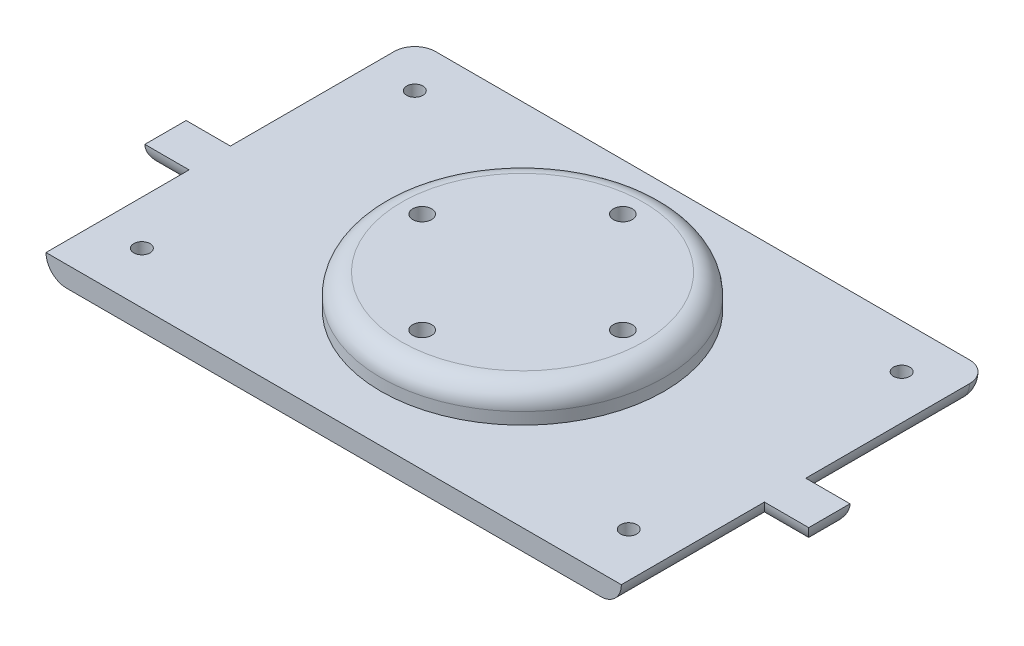
from build123d import *

# Parameters (mm, degrees)
SKETCH2_W               = 195
SKETCH2_H               = 125
BOSS_EXTRUDE1_DEPTH     = 57
SKETCH3_W               = 181
SKETCH3_H               = 118
CUT_EXTRUDE1_DEPTH      = 50
BOSS_EXTRUDE2_DEPTH     = 15
CUT_EXTRUDE4_REACH      = 179.568
SKETCH7_R               = 2.75
SKETCH34_R              = 2
SKETCH34_W              = 22
SKETCH34_H              = 42
CUT_EXTRUDE8_DEPTH      = 7
MIRROR2_COPY_1_DEPTH    = 15
MIRROR2_COPY_2_REACH    = 179.568
MIRROR2_COPY_2_SKETCH_R = 2.75
MIRROR2_COPY_3_SKETCH_R = 2
MIRROR2_COPY_3_SKETCH_W = 22
MIRROR2_COPY_3_SKETCH_H = 42
MIRROR2_COPY_3_DEPTH    = 7
FILLET2_R               = 7
FILLET7_R               = 7
BOSS_EXTRUDE8_REACH     = 282.009
BOSS_EXTRUDE9_REACH     = 282.009
SKETCH29_W              = 460.325022979
SKETCH29_H              = 444.411594697
CUT_EXTRUDE5_DEPTH      = 50
SKETCH30_R              = 48
BOSS_EXTRUDE10_DEPTH    = 11
SKETCH31_R              = 41
CUT_EXTRUDE6_DEPTH      = 11
SKETCH32_R              = 3.2
CUT_EXTRUDE7_DEPTH      = 7
FILLET8_R               = 7
FILLET11_R              = 6.3
SKETCH37_W              = 42
SKETCH37_H              = 75
BOSS_EXTRUDE11_DEPTH    = 7
SKETCH39_W              = 259.645658498
SKETCH39_H              = 116.30884873
CUT_EXTRUDE9_DEPTH      = 125


with BuildPart() as part:
    # Sketch2 → Boss-Extrude1 (new body)
    with BuildSketch(Plane(origin=(0, 0, 0), x_dir=(1, 0, 0), z_dir=(0, 1, 0))):
        with Locations((0, -62.5)):
            Rectangle(SKETCH2_W, SKETCH2_H)
    boss_extrude1 = extrude(amount=BOSS_EXTRUDE1_DEPTH)

    # Sketch3 → Cut-Extrude1 (cut)
    with BuildSketch(Plane(origin=(0, 57, 0), x_dir=(1, 0, 0), z_dir=(0, 1, 0))):
        with Locations((0, -59)):
            Rectangle(SKETCH3_W, SKETCH3_H)
    cut_extrude1 = extrude(amount=-CUT_EXTRUDE1_DEPTH, mode=Mode.SUBTRACT)

    # Sketch5 → Boss-Extrude2 (add)
    with BuildSketch(Plane.ZY.offset(97.5)):
        Polygon((48.5, 7), (48.5, 0), (62.5, 0), (62.5, 57), (55.5, 57), (55.5, 7), align=None)
    boss_extrude2 = extrude(amount=BOSS_EXTRUDE2_DEPTH)

    # Sketch7 → Cut-Extrude4 (cut, up to next)
    with BuildSketch(Plane.XZ, mode=Mode.PRIVATE) as cut_extrude4_sk1:
        with Locations(Location((-82.5, 17.5, 0), (0, 0, 270))):
            Circle(SKETCH7_R)
    cut_extrude4_tool1 = extrude(cut_extrude4_sk1.sketch, amount=-CUT_EXTRUDE4_REACH, mode=Mode.PRIVATE) & part.part
    # Sketch7 → Cut-Extrude4 (cut, up to next)
    with BuildSketch(Plane.XZ, mode=Mode.PRIVATE) as cut_extrude4_sk2:
        with Locations(Location((-82.5, 110, 0), (0, 0, 270))):
            Circle(SKETCH7_R)
    cut_extrude4_tool2 = extrude(cut_extrude4_sk2.sketch, amount=-CUT_EXTRUDE4_REACH, mode=Mode.PRIVATE) & part.part
    cut_extrude4_1 = cut_extrude4_tool1.solids().sort_by_distance((-82.5, 0, 17.5))[0]
    add(cut_extrude4_1, mode=Mode.SUBTRACT)
    cut_extrude4_2 = cut_extrude4_tool2.solids().sort_by_distance((-82.5, 0, 110))[0]
    add(cut_extrude4_2, mode=Mode.SUBTRACT)
    cut_extrude4 = cut_extrude4_1 + cut_extrude4_2  # Cut-Extrude4 as one shape, for the pattern or mirror that repeats it

    # Sketch34 → Cut-Extrude8 (cut)
    with BuildSketch(Plane.XZ):
        with Locations(Location((-57.3, 88.85, 0), (0, 0, 270))):
            Circle(SKETCH34_R)
        with Locations(Location((-67.3, 88.85, 0), (0, 0, 270))):
            Circle(SKETCH34_R)
        with Locations(Location((-78.45, 63.75, 0), (0, 0, 270))):
            Circle(SKETCH34_R)
        with Locations(Location((-46.15, 63.75, 0), (0, 0, 270))):
            Circle(SKETCH34_R)
        with Locations(Location((-57.3, 38.65, 0), (0, 0, 270))):
            Circle(SKETCH34_R)
        with Locations(Location((-67.3, 38.65, 0), (0, 0, 270))):
            Circle(SKETCH34_R)
        with Locations((-62.3, 63.75)):
            Rectangle(SKETCH34_W, SKETCH34_H)
    cut_extrude8 = extrude(amount=-CUT_EXTRUDE8_DEPTH, mode=Mode.SUBTRACT)

    # Mirror1: Boss-Extrude2, Cut-Extrude4, Cut-Extrude8 across plane
    add(boss_extrude2.mirror(Plane(origin=(0, 0, 0), x_dir=(0, 0, 1), z_dir=(1, 0, 0))))
    add(cut_extrude4.mirror(Plane(origin=(0, 0, 0), x_dir=(0, 0, 1), z_dir=(1, 0, 0))), mode=Mode.SUBTRACT)
    add(cut_extrude8.mirror(Plane(origin=(0, 0, 0), x_dir=(0, 0, 1), z_dir=(1, 0, 0))), mode=Mode.SUBTRACT)

    # Mirror2: Boss-Extrude1, Cut-Extrude1, Boss-Extrude2, Cut-Extrude4, Cut-Extrude8 across plane
    add(boss_extrude1.mirror(Plane.XY))
    add(cut_extrude1.mirror(Plane.XY), mode=Mode.SUBTRACT)
    add(boss_extrude2.mirror(Plane.XY))
    add(cut_extrude4.mirror(Plane.XY), mode=Mode.SUBTRACT)
    add(cut_extrude8.mirror(Plane.XY), mode=Mode.SUBTRACT)

    # Mirror2 copy 1 sketch → Mirror2 copy 1 (add)
    with BuildSketch(Plane(origin=(97.5, 0, 0), x_dir=(0, 0, -1), z_dir=(1, 0, 0))):
        Polygon((48.5, 7), (48.5, 0), (62.5, 0), (62.5, 57), (55.5, 57), (55.5, 7), align=None)
    extrude(amount=MIRROR2_COPY_1_DEPTH)

    # Mirror2 copy 2 sketch → Mirror2 copy 2 (cut, up to next)
    with BuildSketch(Plane(origin=(0, 0, 0), x_dir=(-1, 0, 0), z_dir=(0, -1, 0)), mode=Mode.PRIVATE) as mirror2_copy_2_sk1:
        with Locations(Location((-82.5, 17.5, 0), (0, 0, 270))):
            Circle(MIRROR2_COPY_2_SKETCH_R)
    mirror2_copy_2_tool1 = extrude(mirror2_copy_2_sk1.sketch, amount=-MIRROR2_COPY_2_REACH, mode=Mode.PRIVATE) & part.part
    # Mirror2 copy 2 sketch → Mirror2 copy 2 (cut, up to next)
    with BuildSketch(Plane(origin=(0, 0, 0), x_dir=(-1, 0, 0), z_dir=(0, -1, 0)), mode=Mode.PRIVATE) as mirror2_copy_2_sk2:
        with Locations(Location((-82.5, 110, 0), (0, 0, 270))):
            Circle(MIRROR2_COPY_2_SKETCH_R)
    mirror2_copy_2_tool2 = extrude(mirror2_copy_2_sk2.sketch, amount=-MIRROR2_COPY_2_REACH, mode=Mode.PRIVATE) & part.part
    add(mirror2_copy_2_tool1.solids().sort_by_distance((82.5, 0, -17.5))[0], mode=Mode.SUBTRACT)
    add(mirror2_copy_2_tool2.solids().sort_by_distance((82.5, 0, -110))[0], mode=Mode.SUBTRACT)

    # Mirror2 copy 3 sketch → Mirror2 copy 3 (cut)
    with BuildSketch(Plane(origin=(0, 0, 0), x_dir=(-1, 0, 0), z_dir=(0, -1, 0))):
        with Locations(Location((-57.3, 88.85, 0), (0, 0, 270))):
            Circle(MIRROR2_COPY_3_SKETCH_R)
        with Locations(Location((-67.3, 88.85, 0), (0, 0, 270))):
            Circle(MIRROR2_COPY_3_SKETCH_R)
        with Locations(Location((-78.45, 63.75, 0), (0, 0, 270))):
            Circle(MIRROR2_COPY_3_SKETCH_R)
        with Locations(Location((-46.15, 63.75, 0), (0, 0, 270))):
            Circle(MIRROR2_COPY_3_SKETCH_R)
        with Locations(Location((-57.3, 38.65, 0), (0, 0, 270))):
            Circle(MIRROR2_COPY_3_SKETCH_R)
        with Locations(Location((-67.3, 38.65, 0), (0, 0, 270))):
            Circle(MIRROR2_COPY_3_SKETCH_R)
        with Locations((-62.3, 63.75)):
            Rectangle(MIRROR2_COPY_3_SKETCH_W, MIRROR2_COPY_3_SKETCH_H)
    extrude(amount=-MIRROR2_COPY_3_DEPTH, mode=Mode.SUBTRACT)

    # Fillet2
    fillet2_edges = [part.edges().sort_by_distance(p)[0] for p in [
        (-97.5, 28.5, -125),
        (97.5, 28.5, -125),
        (97.5, 28.5, 125),
        (-97.5, 28.5, 125),
    ]]
    fillet(fillet2_edges, radius=FILLET2_R)

    # Fillet7
    fillet7_edges = [part.edges().sort_by_distance(p)[0] for p in [
        (97.5, 0, 0),
        (-97.5, 0, 0),
        (97.5, 0, -90.25),
        (-97.5, 0, 90.25),
        (97.5, 0, 90.25),
        (-97.5, 0, -90.25),
        (0, 0, -125),
        (0, 0, 125),
        (112.5, 0, 55.5),
        (105, 0, 62.5),
        (105, 0, 48.5),
        (-112.5, 0, -55.5),
        (-105, 0, -62.5),
        (-105, 0, -48.5),
        (105, 0, -48.5),
        (105, 0, -62.5),
        (112.5, 0, -55.5),
        (-105, 0, 48.5),
        (-105, 0, 62.5),
        (-95.449747468, 0, 122.949747468),
        (-95.449747468, 0, -122.949747468),
        (95.449747468, 0, -122.949747468),
        (95.449747468, 0, 122.949747468),
        (-112.5, 0, 55.5),
    ]]
    fillet(fillet7_edges, radius=FILLET7_R - 0.0001)  # a hair under: the kernel refuses the full size

    # Sketch26 → Boss-Extrude8 (add, up to next)
    with BuildSketch(Plane.XY.offset(125), mode=Mode.PRIVATE) as boss_extrude8_sk1:
        with BuildLine():
            Line((-90.5, 7), (90.5, 7))
            ThreePointArc((90.5, 7), (88.449747468, 2.050252532), (83.5, 0))
            Line((83.5, 0), (-83.5, 0))
            ThreePointArc((-83.5, 0), (-88.449747468, 2.050252532), (-90.5, 7))
        make_face()
    boss_extrude8_tool1 = extrude(boss_extrude8_sk1.sketch, amount=-BOSS_EXTRUDE8_REACH, mode=Mode.PRIVATE) - part.part
    add(boss_extrude8_tool1.solids().sort_by_distance((0, 3.532685, 125))[0])

    # Sketch27 → Boss-Extrude9 (add, up to next)
    with BuildSketch(Plane(origin=(0, 0, -125), x_dir=(-1, 0, 0), z_dir=(0, 0, -1)), mode=Mode.PRIVATE) as boss_extrude9_sk1:
        with BuildLine():
            Line((-90.5, 7), (90.5, 7))
            ThreePointArc((90.5, 7), (88.449747468, 2.050252532), (83.5, 0))
            Line((83.5, 0), (-83.5, 0))
            ThreePointArc((-83.5, 0), (-88.449747468, 2.050252532), (-90.5, 7))
        make_face()
    boss_extrude9_tool1 = extrude(boss_extrude9_sk1.sketch, amount=-BOSS_EXTRUDE9_REACH, mode=Mode.PRIVATE) - part.part
    add(boss_extrude9_tool1.solids().sort_by_distance((0, 3.532685, -125))[0])

    # Sketch29 → Cut-Extrude5 (cut)
    with BuildSketch(Plane(origin=(0, 57, 0), x_dir=(1, 0, 0), z_dir=(0, 1, 0))):
        with Locations((1.552529588, 6.210118353)):
            Rectangle(SKETCH29_W, SKETCH29_H)
    extrude(amount=-CUT_EXTRUDE5_DEPTH, mode=Mode.SUBTRACT)

    # Sketch30 → Boss-Extrude10 (add)
    with BuildSketch(Plane(origin=(0, 7, 0), x_dir=(1, 0, 0), z_dir=(0, 1, 0))):
        with Locations(Location((0, 64, 0), (0, 0, 0.616739929))):
            Circle(SKETCH30_R)
    extrude(amount=BOSS_EXTRUDE10_DEPTH)

    # Sketch31 → Cut-Extrude6 (cut)
    with BuildSketch(Plane.XZ):
        with Locations(Location((0, -64, 0), (0, 0, 270))):
            Circle(SKETCH31_R)
    extrude(amount=-CUT_EXTRUDE6_DEPTH, mode=Mode.SUBTRACT)

    # Sketch32 → Cut-Extrude7 (cut)
    with BuildSketch(Plane.XZ.offset(-11)):
        with Locations(Location((0, -30, 0), (0, 0, 270))):
            Circle(SKETCH32_R)
        with Locations(Location((0, -98, 0), (0, 0, 270))):
            Circle(SKETCH32_R)
        with Locations(Location((34, -64, 0), (0, 0, 270))):
            Circle(SKETCH32_R)
        with Locations(Location((-34, -64, 0), (0, 0, 270))):
            Circle(SKETCH32_R)
    extrude(amount=-CUT_EXTRUDE7_DEPTH, mode=Mode.SUBTRACT)

    # Fillet8
    fillet8_edges = [part.edges().sort_by_distance(p)[0] for p in [
        (-47.997219225, 18, -63.483331143),
    ]]
    fillet(fillet8_edges, radius=FILLET8_R)

    # Fillet11
    fillet11_edges = [part.edges().sort_by_distance(p)[0] for p in [
        (73.3, 3.5, 84.75),
        (73.3, 3.5, 42.75),
        (51.3, 3.5, 42.75),
        (51.3, 3.5, 84.75),
        (-51.3, 3.5, 42.75),
        (-51.3, 3.5, 84.75),
        (-73.3, 3.5, 84.75),
        (-73.3, 3.5, 42.75),
    ]]
    fillet(fillet11_edges, radius=FILLET11_R)

    # Sketch37 → Boss-Extrude11 (add)
    with BuildSketch(Plane.XZ):
        with Locations((64.5, -62.5)):
            Rectangle(SKETCH37_W, SKETCH37_H)
        with Locations((-64.5, -62.5)):
            Rectangle(SKETCH37_W, SKETCH37_H)
    extrude(amount=-BOSS_EXTRUDE11_DEPTH)

    # Sketch39 → Cut-Extrude9 (cut)
    with BuildSketch(Plane.XY.offset(125)):
        with Locations((-5.095435278, 8.271148339)):
            Rectangle(SKETCH39_W, SKETCH39_H)
    extrude(amount=-CUT_EXTRUDE9_DEPTH, mode=Mode.SUBTRACT)


solid = part.part
